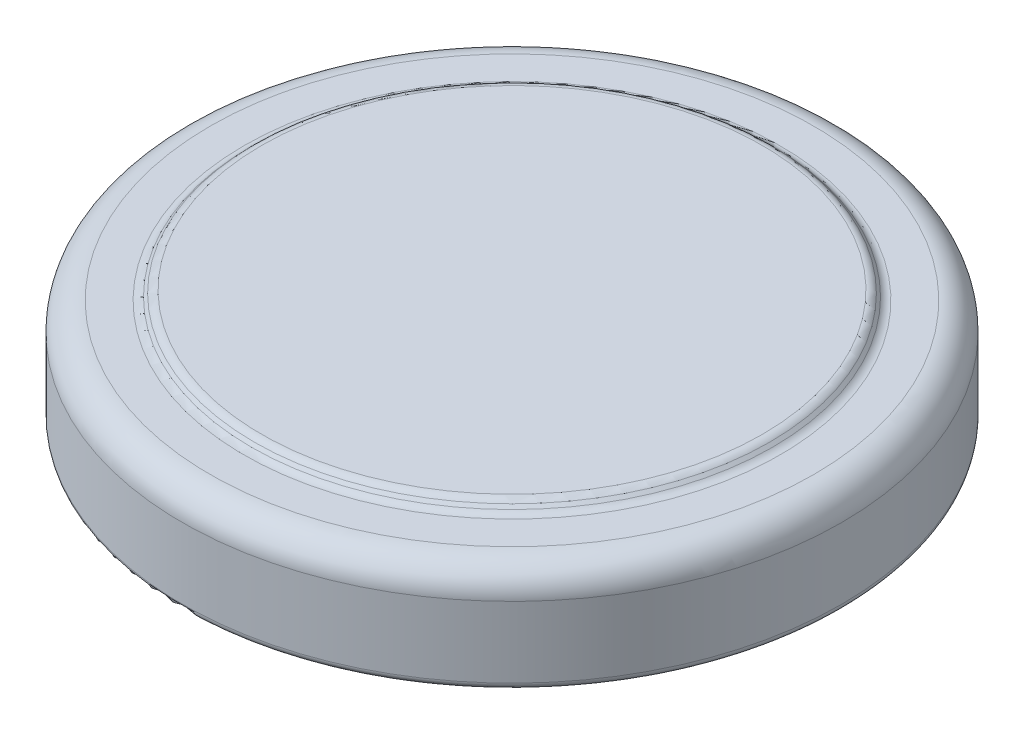
from build123d import *


with BuildPart() as part:
    # Sketch1 → Revolve1 (revolve)
    with BuildSketch(Plane.XY):
        with BuildLine():
            Line((0, 0), (-4.65, 0))
            ThreePointArc((-4.65, 0), (-4.720710678, 0.029289322), (-4.75, 0.1))
            Line((-4.75, 0.1), (-4.75, 1.12))
            ThreePointArc((-4.75, 1.12), (-4.632842712, 1.402842712), (-4.35, 1.52))
            Line((-4.35, 1.52), (-3.862132034, 1.52))
            ThreePointArc((-3.862132034, 1.52), (-3.80472952, 1.53141807), (-3.756066017, 1.563933983))
            Line((-3.756066017, 1.563933983), (-3.713933983, 1.606066017))
            ThreePointArc((-3.713933983, 1.606066017), (-3.66527048, 1.63858193), (-3.607867966, 1.65))
            Line((-3.607867966, 1.65), (0, 1.65))
            Line((0, 1.65), (0, 0))
        make_face()
    revolve(axis=Axis((0, 1.65, 0), (0, -1, 0)))


solid = part.part
